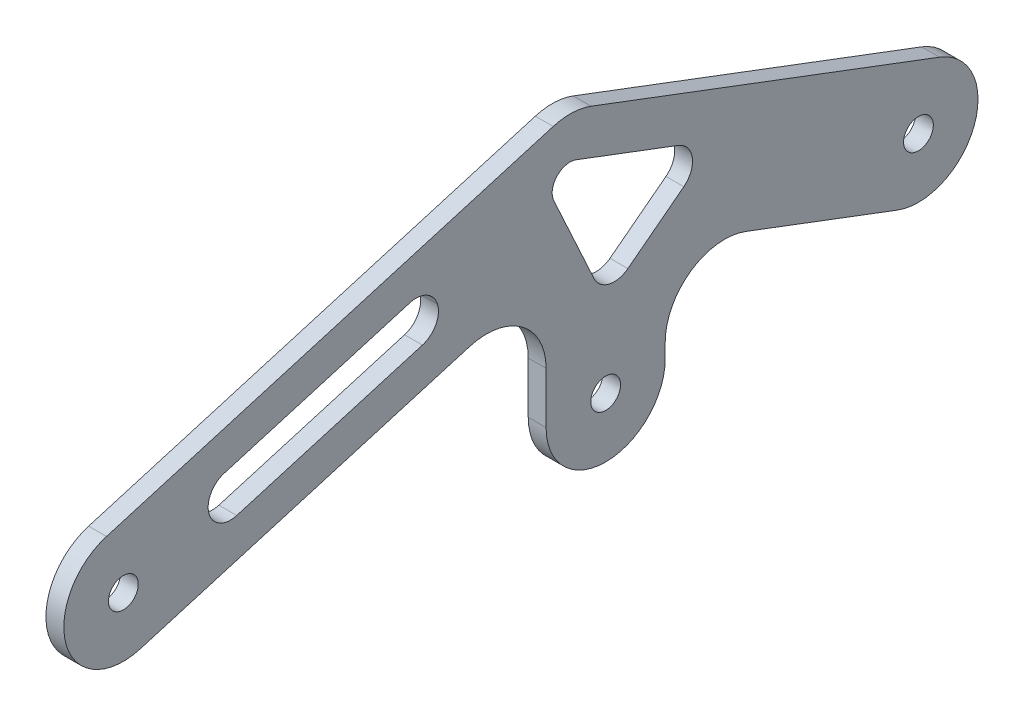
from build123d import *

# Parameters (mm, degrees)
SKETCH3_R           = 3
SKETCH3_R_2         = 2.5
BOSS_EXTRUDE2_DEPTH = 3
FILLET1_R           = 10
CUT_EXTRUDE1_DEPTH  = 10
FILLET2_R           = 3.75


with BuildPart() as part:
    # Sketch3 → Boss-Extrude2 (new body)
    with BuildSketch(Plane(origin=(0, 0, 0), x_dir=(0, 0, -1), z_dir=(1, 0, 0))):
        with BuildLine():
            Line((7.171582169, 19.591665787), (82.171582169, 41.707880218))
            ThreePointArc((82.171582169, 41.707880218), (85.373366716, 42.109241865), (88.536274395, 41.470077986))
            Line((88.536274395, 41.470077986), (147.036274395, 19.353863555))
            ThreePointArc((147.036274395, 19.353863555), (152.853863555, 6.463725605), (139.963725605, 0.646136445))
            Line((139.963725605, 0.646136445), (100.980229255, 15.384040113))
            Line((100.980229255, 15.384040113), (100.980229255, -1.493532665))
            ThreePointArc((100.980229255, -1.493532665), (90.980229255, -11.493532665), (80.980229255, -1.493532665))
            Line((80.980229255, -1.493532665), (80.980229255, 20.505135217))
            Line((80.980229255, 20.505135217), (12.828417831, 0.408334213))
            ThreePointArc((12.828417831, 0.408334213), (0.408334213, 7.171582169), (7.171582169, 19.591665787))
        make_face()
        with Locations((85, 32.116214431)):
            Circle(SKETCH3_R, mode=Mode.SUBTRACT)
        with Locations((90.980229255, -1.493532665)):
            Circle(SKETCH3_R_2, mode=Mode.SUBTRACT)
        with Locations((10, 10)):
            Circle(SKETCH3_R_2, mode=Mode.SUBTRACT)
        with Locations((143.5, 10)):
            Circle(SKETCH3_R_2, mode=Mode.SUBTRACT)
    extrude(amount=BOSS_EXTRUDE2_DEPTH)

    # Fillet1
    fillet1_edges = [part.edges().sort_by_distance(p)[0] for p in [
        (1.5, 20.505135217, -80.980229255),
        (1.5, 15.384040113, -100.980229255),
    ]]
    fillet(fillet1_edges, radius=FILLET1_R)

    # Sketch5 → Cut-Extrude1 (cut)
    with BuildSketch(Plane(origin=(0, 0, 0), x_dir=(0, 0, -1), z_dir=(1, 0, 0))):
        Polygon((23.326841994, 17.839501416), (61.693505144, 29.153172739), (63.814818517, 21.959423399), (25.448155367, 10.645752076), align=None)
        with BuildLine():
            Line((86.060882319, 34.922373497), (109.445541205, 26.081687509))
            Line((109.445541205, 26.081687509), (90.980229255, 11.910433147))
            Line((90.980229255, 11.910433147), (82.273860108, 30.863951963))
            ThreePointArc((82.273860108, 30.863951963), (82.806608326, 34.162927153), (86.060882319, 34.922373497))
        make_face()
    extrude(amount=CUT_EXTRUDE1_DEPTH, mode=Mode.SUBTRACT)

    # Fillet2
    fillet2_edges = [part.edges().sort_by_distance(p)[0] for p in [
        (1.5, 11.910433147, -90.980229255),
        (1.5, 26.081687509, -109.445541205),
        (1.5, 29.153172739, -61.693505144),
        (1.5, 21.959423399, -63.814818517),
        (1.5, 10.645752076, -25.448155367),
        (1.5, 17.839501416, -23.326841994),
    ]]
    fillet(fillet2_edges, radius=FILLET2_R - 0.0001)  # a hair under: the kernel refuses the full size


solid = part.part
